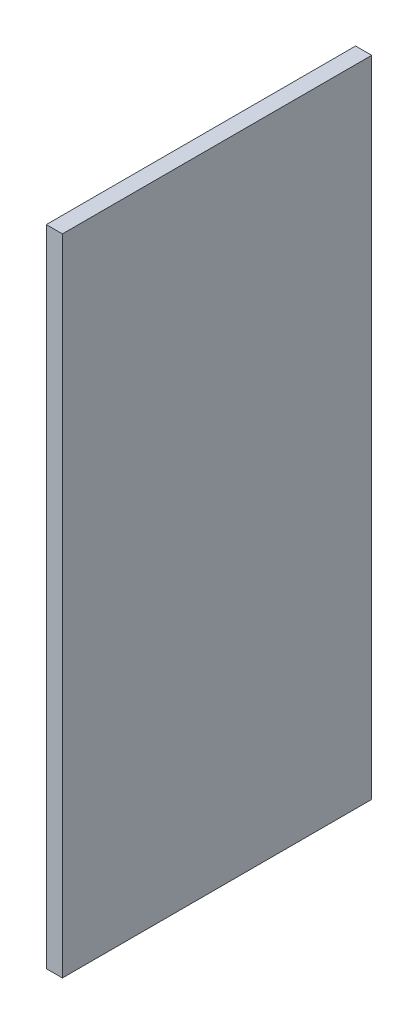
from build123d import *

# Parameters (mm, degrees)
SKETCH1_W           = 60.96
SKETCH1_H           = 127
BOSS_EXTRUDE1_DEPTH = 3.175


with BuildPart() as part:
    # Sketch1 → Boss-Extrude1 (new body)
    with BuildSketch(Plane(origin=(0, 0, 0), x_dir=(0, 0, -1), z_dir=(1, 0, 0))):
        with Locations((30.48, 63.5)):
            Rectangle(SKETCH1_W, SKETCH1_H)
    extrude(amount=BOSS_EXTRUDE1_DEPTH)


solid = part.part
